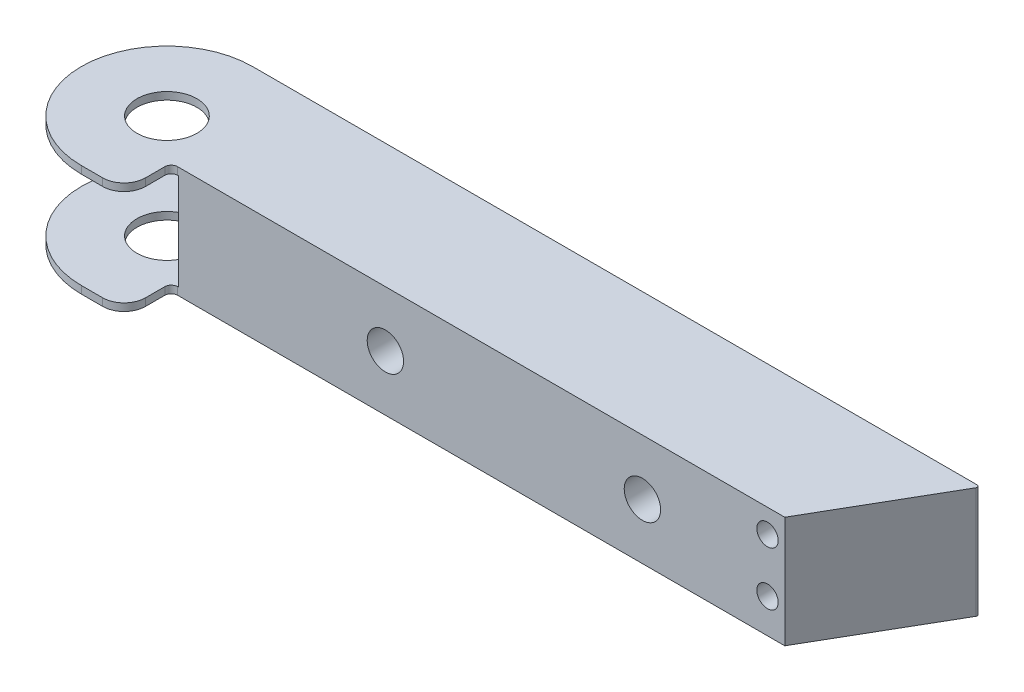
from build123d import *

# Parameters (mm, degrees)
BOSS_EXTRUDE1_DEPTH    = 5.5
CUT_EXTRUDE1_DEPTH     = 3.5
FILLET2_R              = 4
SKETCH19_R             = 1.4
CUT_EXTRUDE3_DEPTH     = 6.3
SKETCH21_R             = 2.4
CUT_EXTRUDE4_DEPTH     = 4.5
BOSS_EXTRUDE3_DEPTH    = 1.3
FILLET5_R              = 0.3
FILLET6_R              = 1
BOSS_EXTRUDE4_DEPTH    = 5.5
SKETCH13_R             = 0.5
CUT_EXTRUDE5_DEPTH     = 6.5
FILLET7_R              = 0.1
SKETCH30_W             = 41.665308381
SKETCH30_H             = 8.97901041
CUT_EXTRUDE6_DEPTH     = 0.15
SKETCH31_W             = 41.594909832
SKETCH31_H             = 8.905627214
CUT_EXTRUDE7_DEPTH     = 0.15
M1_6_CLEARANCE_HOLE1_D = 1.7
CUT_EXTRUDE8_DEPTH     = 4.5


with BuildPart() as part:
    # Sketch1 → Boss-Extrude1 (new body)
    with BuildSketch(Plane(origin=(0, 0, 0), x_dir=(1, 0, 0), z_dir=(0, 1, 0))):
        Polygon((0, 0), (38, 0), (30, -8), (0, -8), align=None)
    extrude(amount=BOSS_EXTRUDE1_DEPTH)

    # Sketch4 → Cut-Extrude1 (cut)
    with BuildSketch(Plane.XY.offset(8)):
        Polygon((0, 0.5), (6, 0.5), (6, 0), (38, 0), (38, 5.5), (6, 5.5), (6, 5), (0, 5), align=None)
    extrude(amount=-CUT_EXTRUDE1_DEPTH, mode=Mode.SUBTRACT)

    # Fillet2
    fillet2_edges = [part.edges().sort_by_distance(p)[0] for p in [
        (0, 5.25, 8),
        (0, 2.75, 0),
    ]]
    fillet(fillet2_edges, radius=FILLET2_R - 0.0001)  # a hair under: the kernel refuses the full size

    # Sketch19 → Cut-Extrude3 (cut)
    with BuildSketch(Plane(origin=(0, 5.5, 0), x_dir=(1, 0, 0), z_dir=(0, 1, 0))):
        with Locations(Location((4, -4, 0), (0, 0, 270))):
            Circle(SKETCH19_R)
    extrude(amount=-CUT_EXTRUDE3_DEPTH, mode=Mode.SUBTRACT)

    # Sketch21 → Cut-Extrude4 (cut)
    with BuildSketch(Plane(origin=(0, 0.5, 0), x_dir=(1, 0, 0), z_dir=(0, 1, 0))):
        with Locations((4, -4)):
            Circle(SKETCH21_R)
    extrude(amount=CUT_EXTRUDE4_DEPTH, mode=Mode.SUBTRACT)

    # Sketch22 → Boss-Extrude3 (add)
    with BuildSketch(Plane.XY.offset(4.5)):
        Polygon((6.347338919, 5), (6, 5), (6, 5.5), (33.5, 5.5), (33.5, 0), (6, 0), (6, 0.5), (6.347338919, 0.5), align=None)
    extrude(amount=BOSS_EXTRUDE3_DEPTH)

    # Fillet5
    fillet5_edges = [part.edges().sort_by_distance(p)[0] for p in [
        (6, 0.25, 5.8),
        (6, 5.25, 5.8),
    ]]
    fillet(fillet5_edges, radius=FILLET5_R)

    # Fillet6
    fillet6_edges = [part.edges().sort_by_distance(p)[0] for p in [
        (6, 5.25, 8),
        (6, 0.25, 8),
    ]]
    fillet(fillet6_edges, radius=FILLET6_R)

    # Sketch25 → Boss-Extrude4 (add)
    with BuildSketch(Plane(origin=(0, 5.5, 0), x_dir=(1, 0, 0), z_dir=(0, 1, 0))):
        Polygon((38, 0), (33.5, -4.5), (33.5, -5.8), (34.646204889, -5.8), align=None)
    extrude(amount=-BOSS_EXTRUDE4_DEPTH)

    # Sketch13 → Cut-Extrude5 (cut)
    with BuildSketch(Plane(origin=(0, 0, 0), x_dir=(-1, 0, 0), z_dir=(0, 0, -1))):
        with Locations((-33.84, 4.25)):
            Circle(SKETCH13_R)
        with Locations((-33.84, 1.75)):
            Circle(SKETCH13_R)
    extrude(amount=-CUT_EXTRUDE5_DEPTH, mode=Mode.SUBTRACT)

    # Fillet7
    fillet7_edges = [part.edges().sort_by_distance(p)[0] for p in [
        (38, 2.75, 0),
    ]]
    fillet(fillet7_edges, radius=FILLET7_R)

    # Sketch30 → Cut-Extrude6 (cut)
    with BuildSketch(Plane(origin=(0, 5.5, 0), x_dir=(1, 0, 0), z_dir=(0, 1, 0))):
        with Locations((19.118021654, -4.03845395)):
            Rectangle(SKETCH30_W, SKETCH30_H)
    extrude(amount=-CUT_EXTRUDE6_DEPTH, mode=Mode.SUBTRACT)

    # Sketch31 → Cut-Extrude7 (cut)
    with BuildSketch(Plane(origin=(0, 0, 0), x_dir=(-1, 0, 0), z_dir=(0, -1, 0))):
        with Locations((-18.959670937, -4.021529517)):
            Rectangle(SKETCH31_W, SKETCH31_H)
    extrude(amount=-CUT_EXTRUDE7_DEPTH, mode=Mode.SUBTRACT)

    # M1.6 Clearance Hole1 (through all)
    with Locations(Plane(origin=(0, 0, 0), x_dir=(-1, 0, 0), z_dir=(0, 0, -1))):
        with Locations((-16, 2.75), (-28, 2.75)):
            Hole(M1_6_CLEARANCE_HOLE1_D / 2)

    # Sketch37 → Cut-Extrude8 (cut)
    with BuildSketch(Plane.XZ.offset(-5)):
        with BuildLine():
            Line((4, -0.442176814), (4, 8.442176814))
            ThreePointArc((4, 8.442176814), (-0.442176814, 4), (4, -0.442176814))
        make_face()
    extrude(amount=CUT_EXTRUDE8_DEPTH, mode=Mode.SUBTRACT)


solid = part.part
